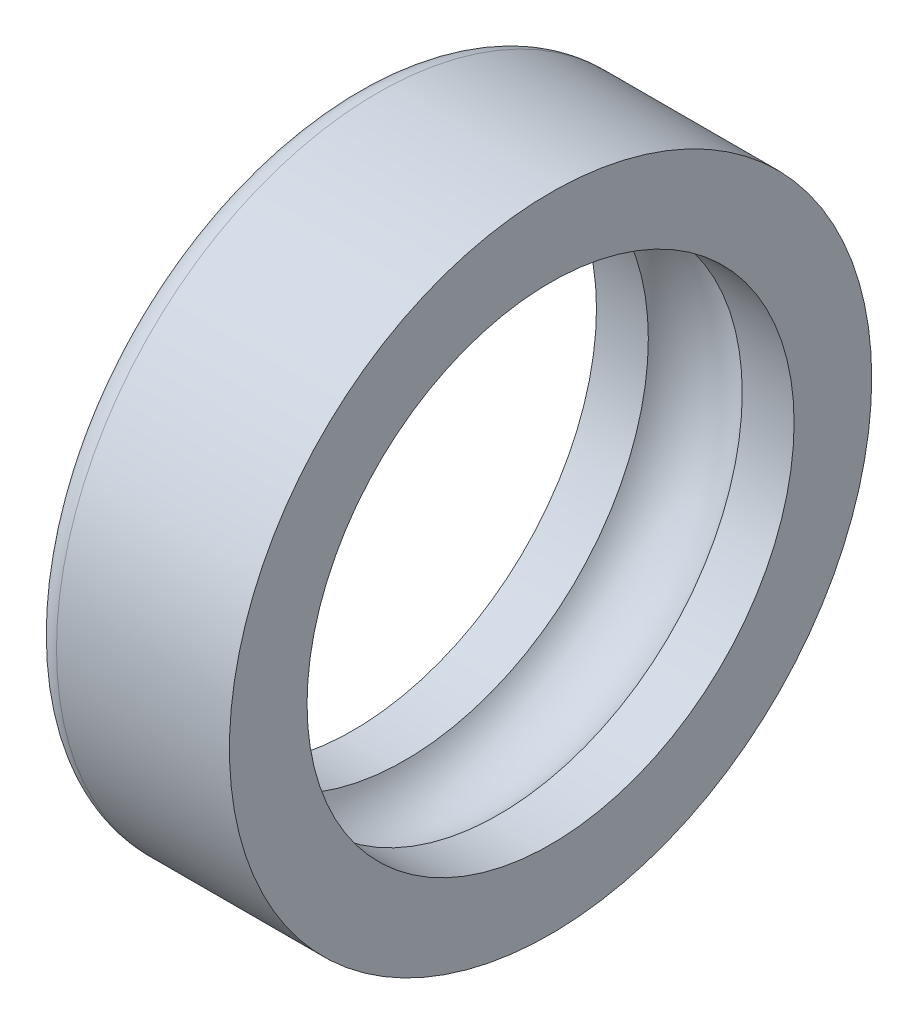
from build123d import *

# Parameters (mm, degrees)
FILLET1_R = 1


with BuildPart() as part:
    # Sketch1 → Revolve1 (revolve)
    with BuildSketch(Plane.XY):
        with BuildLine():
            Line((0, 4.25), (4, 4.25))
            Line((4, 4.25), (4, 1.108))
            Line((4, 1.108), (1.900614637, 1.108))
            ThreePointArc((1.900614637, 1.108), (0, 2.2), (-1.900614637, 1.108))
            Line((-1.900614637, 1.108), (-4, 1.108))
            Line((-4, 1.108), (-4, 4.25))
            Line((-4, 4.25), (0, 4.25))
        make_face()
    revolve(axis=Axis((4, -8.75, 0), (-1, 0, 0)))

    # Fillet1
    fillet1_edges = [part.edges().sort_by_distance(p)[0] for p in [
        (-4, -21.75, 0),
    ]]
    fillet(fillet1_edges, radius=FILLET1_R)


solid = part.part
